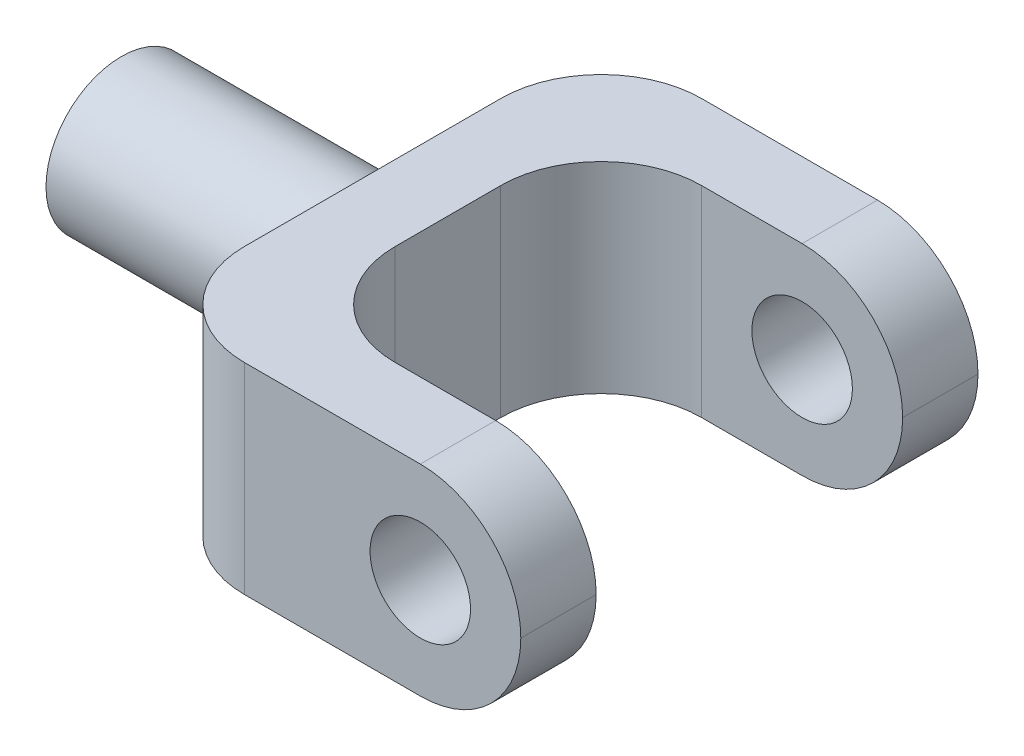
from build123d import *

# Parameters (mm, degrees)
BOSS_EXTRUDE1_DEPTH = 8
SKETCH2_R           = 2
CUT_EXTRUDE1_DEPTH  = 25.031021618
SKETCH3_R           = 3
BOSS_EXTRUDE2_DEPTH = 10
FILLET1_R           = 4
FILLET2_R           = 4


with BuildPart() as part:
    # Sketch1 → Boss-Extrude1 (new body)
    with BuildSketch(Plane(origin=(0, 0, 0), x_dir=(1, 0, 0), z_dir=(0, 1, 0))):
        Polygon((1.5, -6.1), (1.5, 6.1), (13.5, 6.1), (13.5, 9.1), (-1.5, 9.1), (-1.5, -9.1), (13.5, -9.1), (13.5, -6.1), align=None)
    extrude(amount=BOSS_EXTRUDE1_DEPTH)

    # Sketch2 → Cut-Extrude1 (cut, through all)
    with BuildSketch(Plane.XY.offset(9.1)):
        with Locations((9.5, 4)):
            Circle(SKETCH2_R)
    extrude(amount=-CUT_EXTRUDE1_DEPTH, mode=Mode.SUBTRACT)

    # Sketch3 → Boss-Extrude2 (add)
    with BuildSketch(Plane.ZY.offset(1.5)):
        with Locations(Location((0, 4, 0), (0, 0, 180))):
            Circle(SKETCH3_R)
    extrude(amount=BOSS_EXTRUDE2_DEPTH)

    # Fillet1
    fillet1_edges = [part.edges().sort_by_distance(p)[0] for p in [
        (13.5, 8, -7.6),
        (13.5, 0, -7.6),
        (13.5, 0, 7.6),
        (13.5, 8, 7.6),
    ]]
    fillet(fillet1_edges, radius=FILLET1_R - 0.0001)  # a hair under: the kernel refuses the full size

    # Fillet2
    fillet2_edges = [part.edges().sort_by_distance(p)[0] for p in [
        (1.5, 4, -6.1),
        (1.5, 4, 6.1),
        (-1.5, 4, 9.1),
        (-1.5, 4, -9.1),
    ]]
    fillet(fillet2_edges, radius=FILLET2_R)


solid = part.part
